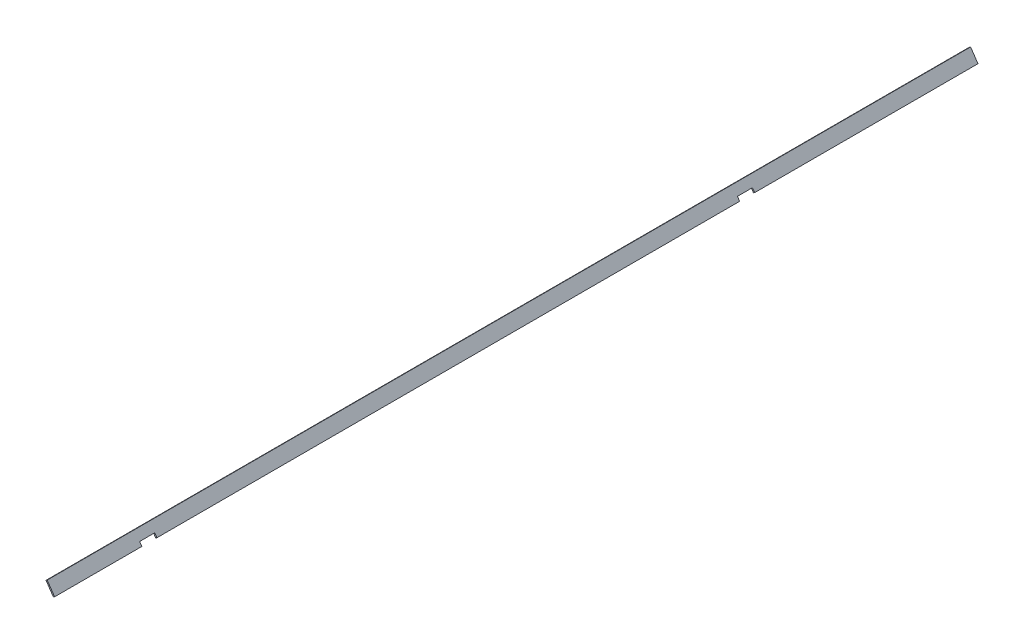
from build123d import *

# Parameters (mm, degrees)
SM_BASE_FLANGE_1_DEPTH = 1900
SKETCH_6_W             = 31
SKETCH_6_H             = 8
CUT_EXTRUDE_1_DEPTH    = 1901.069902905


# Sheet-metal steps are written as plain solids
with BuildPart() as part:
    # Sketch 1 → Базовая кромка1 (new body)
    with BuildSketch(Plane.XY):
        Polygon((12.718479119, 25.259270418), (28, 3), (30.473252269, 4.697946765), (15.191731388, 26.957217183), align=None)
    extrude(amount=-SM_BASE_FLANGE_1_DEPTH)

    # Эскиз6 → Вырез-Вытянуть1 (cut, through all)
    with BuildSketch(Plane(origin=(22.903663606, 15.723912198, 0), x_dir=(0, 0, -1), z_dir=(0.824417422906102, 0.5659822548533315, 0))):
        with Locations((1425, -9.374250867)):
            Rectangle(SKETCH_6_W, SKETCH_6_H)
        with Locations((195, -9.374250867)):
            Rectangle(SKETCH_6_W, SKETCH_6_H)
    extrude(amount=-CUT_EXTRUDE_1_DEPTH, mode=Mode.SUBTRACT)


solid = part.part
